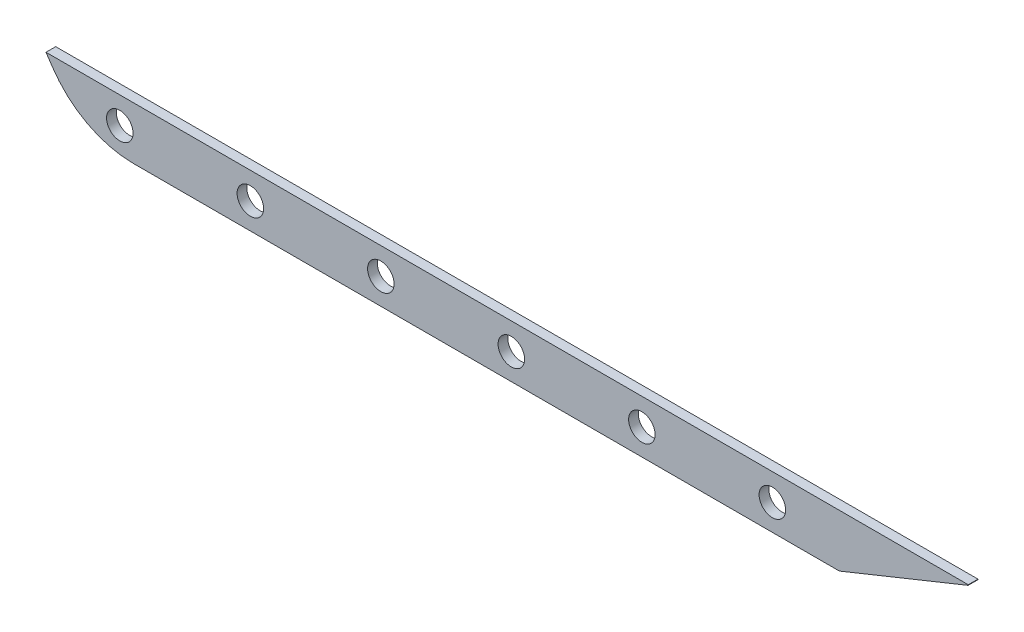
from build123d import *

# Parameters (mm, degrees)
BOSS_EXTRUDE1_DEPTH = 4.7625
SKETCH1_4_R         = 6.5
CUT_EXTRUDE1_DEPTH  = 439.920211962
FILLET1_R           = 48
CUT_EXTRUDE3_DEPTH  = 10
CUT_EXTRUDE5_DEPTH  = 10


with BuildPart() as part:
    # Sketch1 → Boss-Extrude1 (new body)
    with BuildSketch(Plane.XY):
        Polygon((428.120588235, 28.939617947), (0.540381846, 28.939617947), (-115.605170134, 28.939617947), (-98.879411765, 3.850980392), (-31.879411765, -96.649019608), (366, -96.649019608), (403.120588235, -71.149019608), align=None)
    extrude(amount=BOSS_EXTRUDE1_DEPTH)

    # Sketch1<4> → Cut-Extrude1 (cut, through all)
    with BuildSketch(Plane.XY):
        with Locations((-12.879411765, -83.899019608)):
            Circle(SKETCH1_4_R)
        with Locations((51.120588235, -83.899019608)):
            Circle(SKETCH1_4_R)
        with Locations((115.120588235, -83.899019608)):
            Circle(SKETCH1_4_R)
        with Locations((179.120588235, -83.899019608)):
            Circle(SKETCH1_4_R)
        with Locations((243.120588235, -83.899019608)):
            Circle(SKETCH1_4_R)
        with Locations((307.120588235, -83.899019608)):
            Circle(SKETCH1_4_R)
    extrude(amount=CUT_EXTRUDE1_DEPTH, mode=Mode.SUBTRACT)

    # Fillet1
    fillet1_edges = [part.edges().sort_by_distance(p)[0] for p in [
        (-31.879411765, -96.649019608, 2.38125),
    ]]
    fillet(fillet1_edges, radius=FILLET1_R)

    # Sketch7 → Cut-Extrude3 (cut)
    with BuildSketch(Plane.XY.offset(4.7625)):
        Polygon((403.120588235, -71.149019608), (340.005873473, -96.649019608), (366, -96.649019608), align=None)
    extrude(amount=-CUT_EXTRUDE3_DEPTH, mode=Mode.SUBTRACT)

    # Sketch10 → Cut-Extrude5 (cut)
    with BuildSketch(Plane.XY.offset(4.7625)):
        Polygon((-49.086078431, -70.839019608), (403.198019602, -70.839019608), (428.120588235, 28.939617947), (-115.605170134, 28.939617947), align=None)
    extrude(amount=-CUT_EXTRUDE5_DEPTH, mode=Mode.SUBTRACT)


solid = part.part
